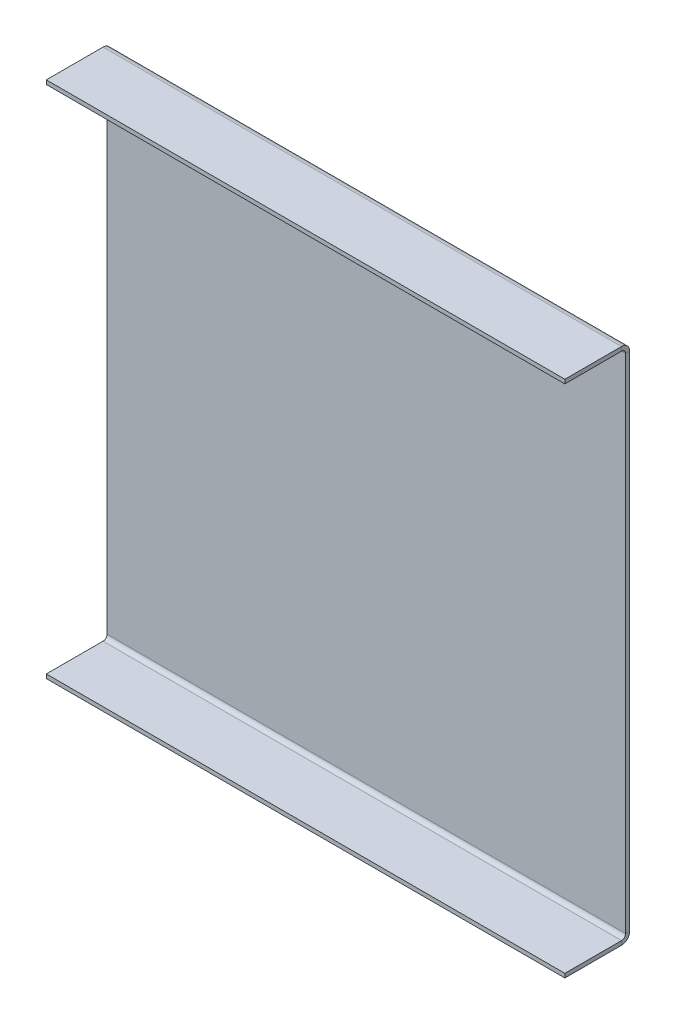
from build123d import *

# Parameters (mm, degrees)
SKETCH1_W                      = 203.2
SKETCH1_H                      = 203.2
BOSS_EXTRUDE2_DEPTH            = 1.5875
EDGE_FLANGE1_STRIP_W           = 9.525
EDGE_FLANGE1_STRIP_H           = 1.5875
EDGE_FLANGE1_STRIP_CUT_DEPTH   = 203.2
EDGE_FLANGE1_STRIP_2_W         = 9.525
EDGE_FLANGE1_STRIP_2_H         = 1.5875
EDGE_FLANGE1_STRIP_CUT_2_DEPTH = 203.2
EDGE_FLANGE1_DEPTH             = 203.2
EDGE_FLANGE1_BEND_DEPTH        = 203.2


# Sheet-metal steps are written as plain solids
with BuildPart() as part:
    # Sketch1 → Boss-Extrude2 (new body)
    with BuildSketch(Plane.XY):
        with Locations((101.6, 101.6)):
            Rectangle(SKETCH1_W, SKETCH1_H)
    extrude(amount=BOSS_EXTRUDE2_DEPTH)

    # Edge-Flange1 strip (across the edge) → Edge-Flange1 strip cut (cut)
    with BuildSketch(Plane(origin=(203.2, 203.2, 1.5875), x_dir=(0, -1, 0), z_dir=(-1, 0, 0))):
        with Locations((-1.5875, -0.79375)):
            Rectangle(EDGE_FLANGE1_STRIP_W, EDGE_FLANGE1_STRIP_H)
    extrude(amount=EDGE_FLANGE1_STRIP_CUT_DEPTH, mode=Mode.SUBTRACT)

    # Edge-Flange1 strip 2 (across the edge) → Edge-Flange1 strip cut 2 (cut)
    with BuildSketch(Plane(origin=(0, 0, 1.5875), x_dir=(0, 1, 0), z_dir=(1, 0, 0))):
        with Locations((-1.5875, -0.79375)):
            Rectangle(EDGE_FLANGE1_STRIP_2_W, EDGE_FLANGE1_STRIP_2_H)
    extrude(amount=EDGE_FLANGE1_STRIP_CUT_2_DEPTH, mode=Mode.SUBTRACT)

    # Edge-Flange1 section (across the edge) → Edge-Flange1 (add)
    with BuildSketch(Plane(origin=(203.2, 203.2, 1.5875), x_dir=(0, -1, 0), z_dir=(-1, 0, 0))):
        with BuildLine():
            Line((0, 1.5875), (0, 23.8125))
            Line((0, 23.8125), (1.5875, 23.8125))
            Line((1.5875, 23.8125), (1.5875, 1.5875))
            ThreePointArc((1.5875, 1.5875), (2.052467985, 0.464967985), (3.175, 0))
            Line((3.175, 0), (3.175, -1.5875))
            ThreePointArc((3.175, -1.5875), (0.92993597, -0.65756403), (0, 1.5875))
        make_face()
    extrude(amount=EDGE_FLANGE1_DEPTH)

    # Edge-Flange1 section 2 (across the edge) → Edge-Flange1 bend (add)
    with BuildSketch(Plane(origin=(0, 0, 1.5875), x_dir=(0, 1, 0), z_dir=(1, 0, 0))):
        with BuildLine():
            Line((0, 1.5875), (0, 23.8125))
            Line((0, 23.8125), (1.5875, 23.8125))
            Line((1.5875, 23.8125), (1.5875, 1.5875))
            ThreePointArc((1.5875, 1.5875), (2.052467985, 0.464967985), (3.175, 0))
            Line((3.175, 0), (3.175, -1.5875))
            ThreePointArc((3.175, -1.5875), (0.92993597, -0.65756403), (0, 1.5875))
        make_face()
    extrude(amount=EDGE_FLANGE1_BEND_DEPTH)


solid = part.part
